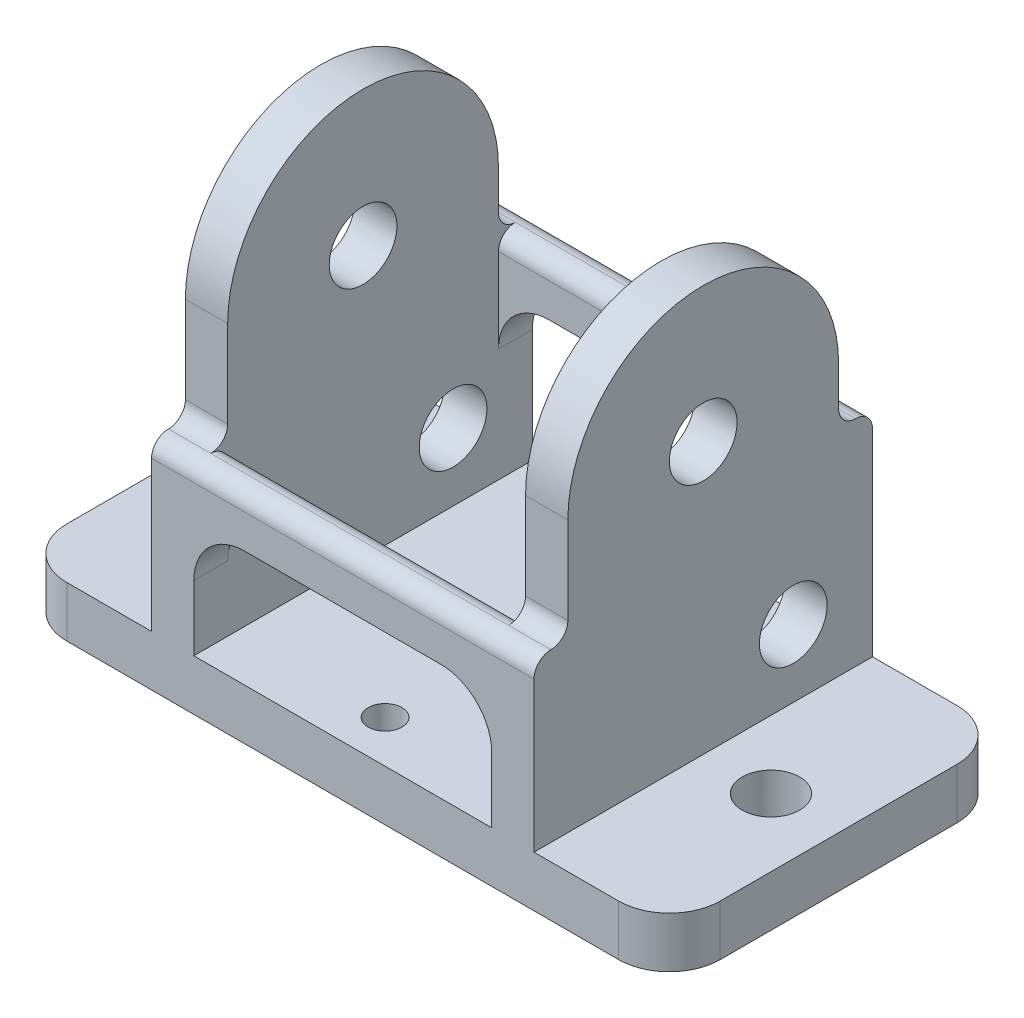
from build123d import *

# Parameters (mm, degrees)
ESQUISSE2_W                    = 2.5
ESQUISSE2_H                    = 6
BOSS_EXTRU_1_START             = -2.5
ESQUISSE3_R                    = 2
BOSS_EXTRU_1_DEPTH             = 2.5
BOSS_EXTRU_2_START             = -2.5
ESQUISSE3_3_W                  = 20
ESQUISSE3_3_H                  = 3
ESQUISSE3_3_W_2                = 2
BOSS_EXTRU_2_DEPTH             = 8.8
ESQUISSE3_5_W                  = 20
ESQUISSE3_5_H                  = 3
BOSS_EXTRUDE1_DEPTH            = 8
CUT_EXTRUDE1_REACH             = 34.38
SKETCH4_R                      = 1.7
TROUS_DE_CENTRAGE_2_0MM1_D     = 2
TROUS_DE_CENTRAGE_2_0MM1_DEPTH = 3
FILLET1_R                      = 1
FILLET2_START                  = -8.8
FILLET2_DEPTH                  = 17.6
FILLET2_START_2                = -19.3
FILLET2_2_DEPTH                = 38.6
FILLET3_R                      = 3


with BuildPart() as part:
    # Esquisse2 → Révolution1 (revolve)
    with BuildSketch(Plane.XY, mode=Mode.PRIVATE) as r_volution1_sk:
        with Locations((10.05, 5)):
            Rectangle(ESQUISSE2_W, ESQUISSE2_H)
    revolve(r_volution1_sk.sketch.rotate(Axis((-2.14668318, 0, 0), (1, 0, 0)), 90), axis=Axis((-2.14668318, 0, 0), (1, 0, 0)))

    # Esquisse3 → Boss.-Extru.1 (add)
    with BuildSketch(Plane(origin=(11.3, 0, 0), x_dir=(0, 0, -1), z_dir=(1, 0, 0)).offset(BOSS_EXTRU_1_START)):
        with BuildLine():
            Line((-10, -19), (10, -19))
            Line((10, -19), (10, -3.313708499))
            Line((10, -3.313708499), (8, -3.313708499))
            Line((8, -3.313708499), (8, 0))
            ThreePointArc((8, 0), (0, -8), (-8, 0))
            Line((-8, 0), (-8, -6.142135624))
            Line((-8, -6.142135624), (-10, -6.142135624))
            Line((-10, -6.142135624), (-10, -19))
        make_face()
        with Locations((5.318, -12)):
            Circle(ESQUISSE3_R, mode=Mode.SUBTRACT)
    extrude(amount=BOSS_EXTRU_1_DEPTH)

    # Esquisse3<3> → Boss.-Extru.2 (add)
    with BuildSketch(Plane(origin=(11.3, 0, 0), x_dir=(0, 0, -1), z_dir=(1, 0, 0)).offset(BOSS_EXTRU_2_START)):
        with Locations((0, -17.5)):
            Rectangle(ESQUISSE3_3_W, ESQUISSE3_3_H)
        with Locations((-9, -7.642135624)):
            Rectangle(ESQUISSE3_3_W_2, ESQUISSE3_3_H)
        with Locations((9, -4.813708499)):
            Rectangle(ESQUISSE3_3_W_2, ESQUISSE3_3_H)
    extrude(amount=-BOSS_EXTRU_2_DEPTH)

    # Esquisse3<5> → Boss-Extrude1 (add)
    with BuildSketch(Plane(origin=(11.3, 0, 0), x_dir=(0, 0, -1), z_dir=(1, 0, 0))):
        with Locations((0, -17.5)):
            Rectangle(ESQUISSE3_5_W, ESQUISSE3_5_H)
    extrude(amount=BOSS_EXTRUDE1_DEPTH)

    # Sketch4 → Cut-Extrude1 (cut, up to next)
    with BuildSketch(Plane(origin=(0, -16, 0), x_dir=(1, 0, 0), z_dir=(0, 1, 0)), mode=Mode.PRIVATE) as cut_extrude1_sk1:
        with Locations(Location((15.3, 0, 0), (0, 0, 270))):
            Circle(SKETCH4_R)
    cut_extrude1_tool1 = extrude(cut_extrude1_sk1.sketch, amount=-CUT_EXTRUDE1_REACH, mode=Mode.PRIVATE) & part.part
    add(cut_extrude1_tool1.solids().sort_by_distance((15.3, -16, 0))[0], mode=Mode.SUBTRACT)

    # Symétrie1: part across plane


with BuildPart() as part_1:
    add(part.part)
    add(part.part.mirror(Plane(origin=(0, 0, 0), x_dir=(0, 0, 1), z_dir=(1, 0, 0))))

    # Trous de centrage Ø2.0mm1
    with Locations(Plane(origin=(0, -16, 0), x_dir=(1, 0, 0), z_dir=(0, 1, 0))):
        with Locations((0, -7.5)):
            Hole(TROUS_DE_CENTRAGE_2_0MM1_D / 2, depth=TROUS_DE_CENTRAGE_2_0MM1_DEPTH)

    # Fillet1
    fillet1_edges = [part_1.edges().sort_by_distance(p)[0] for p in [
        (-10.05, -3.313708499, -8),
        (-10.05, -6.142135624, 8),
        (10.05, -3.313708499, -8),
        (10.05, -6.142135624, 8),
    ]]
    fillet(fillet1_edges, radius=FILLET1_R)

    # Fillet2: read off the stored shape, not the designer's step
    # Fillet2 outline → Fillet2 (cut)
    with BuildSketch(Plane.YZ.offset(FILLET2_START)):
        with BuildLine():
            ThreePointArc((-4.313708499, -8), (-3.606601718, -8.292893219), (-3.313708499, -9))
            Line((-3.313708499, -9), (-3.313708499, -8))
            Line((-3.313708499, -8), (-4.313708499, -8))
        make_face()
        with BuildLine():
            ThreePointArc((-3.313708499, -9), (-3.606601718, -9.707106781), (-4.313708499, -10))
            Line((-4.313708499, -10), (-3.313708499, -10))
            Line((-3.313708499, -10), (-3.313708499, -9))
        make_face()
        with BuildLine():
            Line((-6.142135624, 8), (-6.142135624, 9))
            ThreePointArc((-6.142135624, 9), (-6.435028843, 8.292893219), (-7.142135624, 8))
            Line((-7.142135624, 8), (-6.142135624, 8))
        make_face()
        with BuildLine():
            ThreePointArc((-7.142135624, 10), (-6.435028843, 9.707106781), (-6.142135624, 9))
            Line((-6.142135624, 9), (-6.142135624, 10))
            Line((-6.142135624, 10), (-7.142135624, 10))
        make_face()
    extrude(amount=FILLET2_DEPTH, mode=Mode.SUBTRACT)

    # Fillet2 2 outline → Fillet2 2 (cut)
    with BuildSketch(Plane.YZ.offset(FILLET2_START_2)):
        with BuildLine():
            ThreePointArc((-3.313708499, -9), (-3.606601718, -9.707106781), (-4.313708499, -10))
            Line((-4.313708499, -10), (-3.313708499, -10))
            Line((-3.313708499, -10), (-3.313708499, -9))
        make_face()
        with BuildLine():
            ThreePointArc((-7.142135624, 10), (-6.435028843, 9.707106781), (-6.142135624, 9))
            Line((-6.142135624, 9), (-6.142135624, 10))
            Line((-6.142135624, 10), (-7.142135624, 10))
        make_face()
    extrude(amount=FILLET2_2_DEPTH, mode=Mode.SUBTRACT)

    # Fillet3
    fillet3_edges = [part_1.edges().sort_by_distance(p)[0] for p in [
        (-8.8, -6.313708499, -9),
        (-19.3, -17.5, -10),
        (8.8, -6.313708499, -9),
        (8.8, -9.142135624, 9),
        (19.3, -17.5, -10),
        (19.3, -17.5, 10),
        (-8.8, -9.142135624, 9),
        (-19.3, -17.5, 10),
    ]]
    fillet(fillet3_edges, radius=FILLET3_R)


solid = part_1.part
